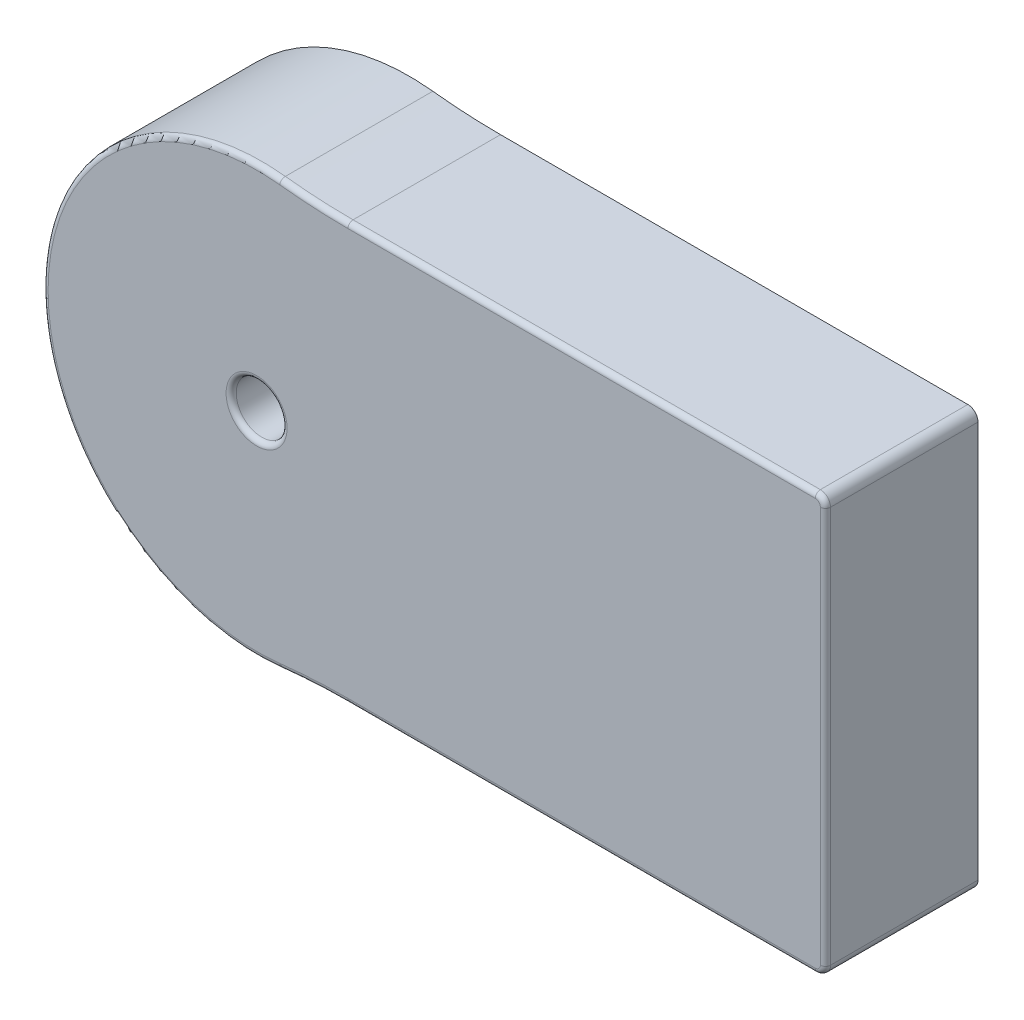
from build123d import *

# Parameters (mm, degrees)
SKETCH_1_R      = 5
EXTRUDE_1_DEPTH = 30
FILLET_1_R      = 120
FILLET_2_R      = 1
FILLET_3_R      = 1
FILLET_4_R      = 2


with BuildPart() as part:
    # 草图1 → 凸台-拉伸1 (new body)
    with BuildSketch(Plane.XY):
        with BuildLine():
            Line((-2.776926107, -43.794806673), (99.984598045, -43.794806673))
            Line((99.984598045, -43.794806673), (99.984598045, 38.205193327))
            Line((99.984598045, 38.205193327), (-2.776926107, 38.205193327))
            ThreePointArc((-2.776926107, 38.205193327), (-53.887359686, -2.794806673), (-2.776926107, -43.794806673))
        make_face()
        with Locations((-11.887359686, -2.794806673)):
            Circle(SKETCH_1_R, mode=Mode.SUBTRACT)
    extrude(amount=EXTRUDE_1_DEPTH)

    # 圆角1
    fillet_1_edges = [part.edges().sort_by_distance(p)[0] for p in [
        (-2.776926107, 38.205193327, 15),
        (-2.776926107, -43.794806673, 15),
    ]]
    fillet(fillet_1_edges, radius=FILLET_1_R)

    # 圆角2
    fillet_2_edges = [part.edges().sort_by_distance(p)[0] for p in [
        (-16.887359686, -2.794806673, 30),
    ]]
    fillet(fillet_2_edges, radius=FILLET_2_R)

    # 圆角3
    fillet_3_edges = [part.edges().sort_by_distance(p)[0] for p in [
        (99.984598045, -2.794806673, 30),
        (-53.887359686, -2.794806673, 30),
        (53.034719557, 38.205193327, 30),
        (53.034719557, -43.794806673, 30),
        (-0.581825597, 38.390521623, 30),
        (-0.581825597, -43.980134969, 30),
    ]]
    fillet(fillet_3_edges, radius=FILLET_3_R)

    # 圆角4
    # the kernel refuses this fillet: 2 mm, written as the material it takes off along each edge
    with BuildSketch(Plane(origin=(97.984598045, -41.794806673, 30), x_dir=(0, -1, 0), z_dir=(-1, 0, 0))) as fillet_4_piece_1:
        with BuildLine():
            CenterArc((1, -1), 1, 0, 90)
            Line((2, -1), (2, 0))
            Line((2, 0), (1, 0))
        make_face()
    revolve(axis=Axis((97.984598045, -41.794806673, 30), (0, 0, 1)), revolution_arc=90, mode=Mode.SUBTRACT)
    with BuildSketch(Plane(origin=(97.984598045, 36.205193327, 30), x_dir=(1, 0, 0), z_dir=(0, -1, 0))) as fillet_4_piece_2:
        with BuildLine():
            CenterArc((1, -1), 1, 0, 90)
            Line((2, -1), (2, 0))
            Line((2, 0), (1, 0))
        make_face()
    revolve(axis=Axis((97.984598045, 36.205193327, 30), (0, 0, 1)), revolution_arc=90, mode=Mode.SUBTRACT)
    with BuildSketch(Plane(origin=(99.984598045, 38.205193327, -5), x_dir=(0, -1, 0), z_dir=(0, 0, 1))) as fillet_4_piece_3:
        with BuildLine():
            CenterArc((FILLET_4_R, -FILLET_4_R), FILLET_4_R, 90, 90)
            Line((0, -FILLET_4_R), (0, 0))
            Line((0, 0), (FILLET_4_R, 0))
        make_face()
    extrude(amount=35, mode=Mode.SUBTRACT)
    with BuildSketch(Plane(origin=(99.984598045, -43.794806673, -5), x_dir=(0, 1, 0), z_dir=(0, 0, 1))) as fillet_4_piece_4:
        with BuildLine():
            CenterArc((FILLET_4_R, FILLET_4_R), FILLET_4_R, 180, 90)
            Line((0, FILLET_4_R), (0, 0))
            Line((0, 0), (FILLET_4_R, 0))
        make_face()
    extrude(amount=35, mode=Mode.SUBTRACT)


solid = part.part
